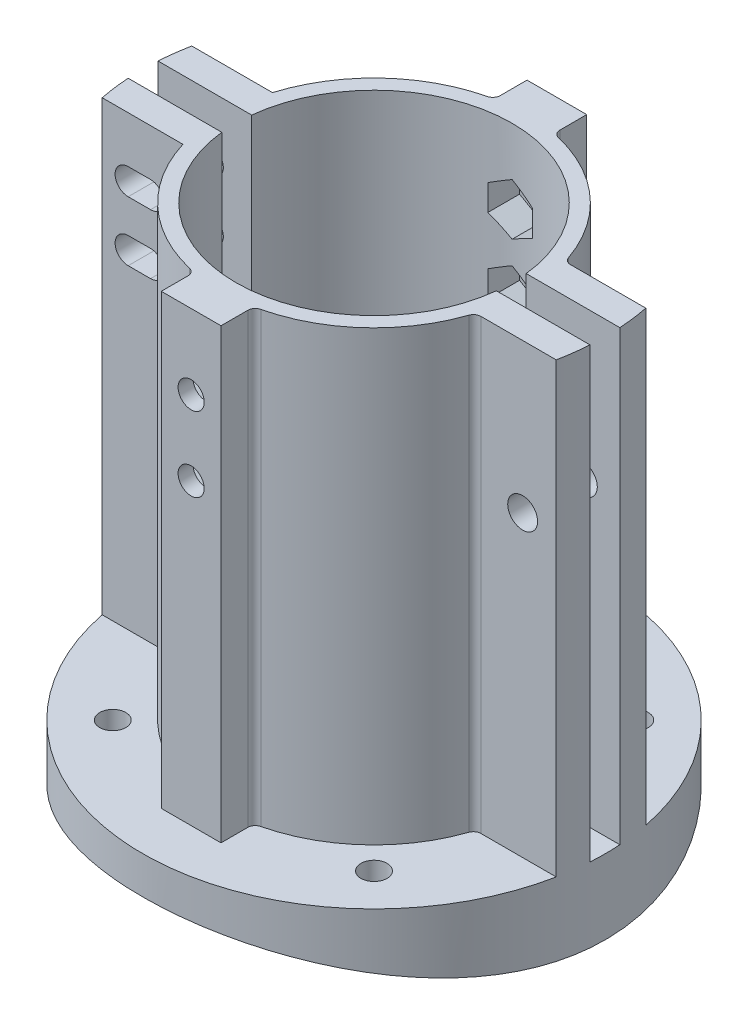
from build123d import *
from build123d.topology import SkipClean

# Parameters (mm, degrees)
SKETCH_1_R               = 31
SKETCH_1_R_2             = 1.75
SKETCH_1_R_3             = 18.5
EXTRUDE_1_DEPTH          = 10
CUT_EXTRUDE_1_DEPTH      = 45.966654312
CUT_EXTRUDE_1_DEPTH_BACK = 45.966654312
SKETCH_3_R               = 20.5
SKETCH_3_R_2             = 18.5
EXTRUDE_2_DEPTH          = 60
SKETCH_5_W               = 2.216851684
SKETCH_5_H               = 4
CUT_EXTRUDE_2_DEPTH      = 60
SKETCH_6_R               = 1.75
CUT_EXTRUDE_3_DEPTH      = 83.595399673
EXTRUDE_3_DEPTH          = 60
SKETCH_8_R               = 2
CUT_EXTRUDE_4_DEPTH      = 86.02940684
EXTRUDE_START            = -0.394031
SKETCH_9_W               = 8
SKETCH_9_H               = 60
SKETCH_9_R               = 1.75
EXTRUDE_4_DEPTH          = 4.394031
FILLET_1_R               = 1
CUT_EXTRUDE_START        = -3.5
CUT_EXTRUDE_5_DEPTH      = 7.5
MIRROR_START             = 48.267949192
MIRROR_1_DEPTH           = 3.464101616
MIRROR_START_2           = 58.267949192
MIRROR_1_2_DEPTH         = 3.464101616
MIRROR_START_3           = 10
MIRROR_1_3_DEPTH         = 38.267949192
MIRROR_START_4           = 48.2499999
MIRROR_1_4_DEPTH         = 21.7500001
MIRROR_START_5           = 61.732050808
MIRROR_1_5_DEPTH         = 8.267949192
MIRROR_START_6           = 51.732050808
MIRROR_1_6_DEPTH         = 6.535898384
MIRROR_START_7           = 17
MIRROR_1_7_DEPTH         = 5.5
MIRROR_START_8           = 22.5
MIRROR_1_8_OUTLINE_R     = 1.75
MIRROR_1_8_DEPTH         = 2.5
CUT_EXTRUDE_START_2      = -9
CUT_EXTRUDE_6_DEPTH      = 9
CUT_EXTRUDE_7_DEPTH      = 86.02940684
EXTRUDE_5_DEPTH          = 60


with BuildPart() as part:
    # Эскиз1 → Бобышка-Вытянуть1 (new body)
    with BuildSketch(Plane(origin=(0, 0, 0), x_dir=(1, 0, 0), z_dir=(0, 1, 0))):
        with Locations(Location((0, 0, 0), (0, 0, 270))):
            Circle(SKETCH_1_R)
        with Locations(Location((17.5, -17.5, 0), (0, 0, 270))):
            Circle(SKETCH_1_R_2, mode=Mode.SUBTRACT)
        with Locations(Location((-17.5, -17.5, 0), (0, 0, 270))):
            Circle(SKETCH_1_R_2, mode=Mode.SUBTRACT)
        with Locations(Location((-17.5, 17.5, 0), (0, 0, 270))):
            Circle(SKETCH_1_R_2, mode=Mode.SUBTRACT)
        with Locations(Location((17.5, 17.5, 0), (0, 0, 270))):
            Circle(SKETCH_1_R_2, mode=Mode.SUBTRACT)
        with Locations(Location((0, 0, 0), (0, 0, 270))):
            Circle(SKETCH_1_R_3, mode=Mode.SUBTRACT)
    extrude(amount=EXTRUDE_1_DEPTH)

    # Эскиз2 → Вырез-Вытянуть1 (cut, two sides: drawn at the far end of the back side and taken through both)
    with BuildSketch(Plane.XY.offset(-CUT_EXTRUDE_1_DEPTH_BACK)):
        with BuildLine():
            Line((-31, 0), (31, 0))
            ThreePointArc((31, 0), (0, 4.978725812), (-31, 0))
        make_face()
    extrude(amount=CUT_EXTRUDE_1_DEPTH + CUT_EXTRUDE_1_DEPTH_BACK, mode=Mode.SUBTRACT)

    # Эскиз3 → Бобышка-Вытянуть2 (add)
    with BuildSketch(Plane(origin=(0, 10, 0), x_dir=(1, 0, 0), z_dir=(0, 1, 0))):
        with Locations(Location((0, 0, 0), (0, 0, 270))):
            Circle(SKETCH_3_R)
        with Locations(Location((0, 0, 0), (0, 0, 90))):
            Circle(SKETCH_3_R_2, mode=Mode.SUBTRACT)
    extrude(amount=EXTRUDE_2_DEPTH)

    # Эскиз5 → Вырез-Вытянуть2 (cut)
    with BuildSketch(Plane(origin=(0, 70, 0), x_dir=(1, 0, 0), z_dir=(0, 1, 0))):
        with Locations((19.5, 0)):
            Rectangle(SKETCH_5_W, SKETCH_5_H)
        with Locations((-19.5, 0)):
            Rectangle(SKETCH_5_W, SKETCH_5_H)
    extrude(amount=-CUT_EXTRUDE_2_DEPTH, mode=Mode.SUBTRACT)

    # Эскиз6 → Вырез-Вытянуть3 (cut, through all)
    with BuildSketch(Plane.XY):
        with Locations(Location((0, 60, 0), (0, 0, 90))):
            Circle(SKETCH_6_R)
        with Locations(Location((0, 50, 0), (0, 0, 90))):
            Circle(SKETCH_6_R)
    extrude(amount=-CUT_EXTRUDE_3_DEPTH, mode=Mode.SUBTRACT)

    # Эскиз7 → Бобышка-Вытянуть3 (add)
    with SkipClean():  # the faces are left unmerged after this step: merging them gives an invalid solid
        with BuildSketch(Plane(origin=(0, 10, 0), x_dir=(1, 0, 0), z_dir=(0, 1, 0))):
            with BuildLine():
                Line((19.602295784, 6), (30.413812651, 6))
                ThreePointArc((30.413812651, 6), (30.739745971, 4.008493192), (30.935416597, 2))
                Line((30.935416597, 2), (20.402205763, 2))
                ThreePointArc((20.402205763, 2), (20.101990847, 4.01994577), (19.602295784, 6))
            make_face()
            with BuildLine():
                Line((19.602295784, -6), (30.413812651, -6))
                ThreePointArc((30.413812651, -6), (30.739745971, -4.008493192), (30.935416597, -2))
                Line((30.935416597, -2), (20.402205763, -2))
                ThreePointArc((20.402205763, -2), (20.101990847, -4.01994577), (19.602295784, -6))
            make_face()
            with BuildLine():
                Line((-20.402205763, -2), (-30.935416597, -2))
                ThreePointArc((-30.935416597, -2), (-30.739745971, -4.008493192), (-30.413812651, -6))
                Line((-30.413812651, -6), (-19.602295784, -6))
                ThreePointArc((-19.602295784, -6), (-20.101990847, -4.01994577), (-20.402205763, -2))
            make_face()
            with BuildLine():
                Line((-19.602295784, 6), (-30.413812651, 6))
                ThreePointArc((-30.413812651, 6), (-30.739745971, 4.008493192), (-30.935416597, 2))
                Line((-30.935416597, 2), (-20.402205763, 2))
                ThreePointArc((-20.402205763, 2), (-20.101990847, 4.01994577), (-19.602295784, 6))
            make_face()
        extrude(amount=EXTRUDE_3_DEPTH)

    # Эскиз8 → Вырез-Вытянуть4 (cut, through all)
    with SkipClean():  # the faces are left unmerged after this step: merging them gives an invalid solid
        with BuildSketch(Plane(origin=(0, 0, -6), x_dir=(-1, 0, 0), z_dir=(0, 0, -1))):
            with Locations((-25.913812651, 50)):
                Circle(SKETCH_8_R)
        extrude(amount=-CUT_EXTRUDE_4_DEPTH, mode=Mode.SUBTRACT)

    # Эскиз9 → Бобышка-Вытянуть4 (add)
    with SkipClean():  # the faces are left unmerged after this step: merging them gives an invalid solid
        with BuildSketch(Plane(origin=(0, 0, -20.5), x_dir=(-1, 0, 0), z_dir=(0, 0, -1)).offset(EXTRUDE_START)):
            with Locations((0, 40)):
                Rectangle(SKETCH_9_W, SKETCH_9_H)
            with Locations(Location((0, 60, 0), (0, 0, 270))):
                Circle(SKETCH_9_R, mode=Mode.SUBTRACT)
            with Locations(Location((0, 50, 0), (0, 0, 270))):
                Circle(SKETCH_9_R, mode=Mode.SUBTRACT)
        extrude(amount=EXTRUDE_4_DEPTH)

    # Скругление1
    fillet_1_edges = [part.edges().sort_by_distance(p)[0] for p in [
        (19.602295784, 40, -6),
        (19.602295784, 40, 6),
        (4, 40, -20.105969),
        (-4, 40, -20.105969),
    ]]
    fillet(fillet_1_edges, radius=FILLET_1_R)

    # Эскиз10 → Вырез-Вытянуть5 (cut)
    with SkipClean():  # the faces are left unmerged after this step: merging them gives an invalid solid
        with BuildSketch(Plane(origin=(0, 0, -18.5), x_dir=(-1, 0, 0), z_dir=(0, 0, -1)).offset(CUT_EXTRUDE_START)):
            Polygon((0, 56.535898385), (3, 58.267949192), (3, 61.732050808), (0, 63.464101615), (-3, 61.732050808), (-3, 58.267949192), align=None)
            Polygon((0, 46.535898385), (3, 48.267949192), (3, 51.732050808), (0, 53.464101615), (-3, 51.732050808), (-3, 48.267949192), align=None)
        extrude(amount=CUT_EXTRUDE_5_DEPTH, mode=Mode.SUBTRACT)

    # Зеркальное отражение1: read off the stored shape, not the designer's step
    # Зеркальное отражение1 outline → Зеркальное отражение1 (cut)
    with SkipClean():  # the faces are left unmerged after this step: merging them gives an invalid solid
        with BuildSketch(Plane(origin=(0, 0, 0), x_dir=(1, 0, 0), z_dir=(0, 1, 0)).offset(MIRROR_START)):
            with BuildLine():
                ThreePointArc((-3, -20.27929979), (0, -20.5), (3, -20.27929979))
                Line((3, -20.27929979), (3, -18.255136264))
                ThreePointArc((3, -18.255136264), (0, -18.5), (-3, -18.255136264))
                Line((-3, -18.255136264), (-3, -20.27929979))
            make_face()
        extrude(amount=MIRROR_1_DEPTH, mode=Mode.SUBTRACT)

    # Mirror 1 2 outline → Mirror 1 2 (cut)
    with SkipClean():  # the faces are left unmerged after this step: merging them gives an invalid solid
        with BuildSketch(Plane(origin=(0, 0, 0), x_dir=(1, 0, 0), z_dir=(0, 1, 0)).offset(MIRROR_START_2)):
            with BuildLine():
                ThreePointArc((-3, -20.27929979), (0, -20.5), (3, -20.27929979))
                Line((3, -20.27929979), (3, -18.255136264))
                ThreePointArc((3, -18.255136264), (0, -18.5), (-3, -18.255136264))
                Line((-3, -18.255136264), (-3, -20.27929979))
            make_face()
        extrude(amount=MIRROR_1_2_DEPTH, mode=Mode.SUBTRACT)

    # Mirror 1 3 outline → Mirror 1 3 (add)
    with SkipClean():  # the faces are left unmerged after this step: merging them gives an invalid solid
        with BuildSketch(Plane(origin=(0, 0, 0), x_dir=(1, 0, 0), z_dir=(0, 1, 0)).offset(MIRROR_START_3)):
            with BuildLine():
                Line((-4, -24.5), (4, -24.5))
                Line((4, -24.5), (4, -20.910523666))
                ThreePointArc((4, -20.910523666), (4.214965561, -20.291071545), (4.76744186, -19.93794117))
                ThreePointArc((4.76744186, -19.93794117), (0, -20.5), (-4.76744186, -19.93794117))
                ThreePointArc((-4.76744186, -19.93794117), (-4.214965561, -20.291071545), (-4, -20.910523666))
                Line((-4, -20.910523666), (-4, -24.5))
            make_face()
        extrude(amount=MIRROR_1_3_DEPTH)

    # Mirror 1 4 outline → Mirror 1 4 (add)
    with SkipClean():  # the faces are left unmerged after this step: merging them gives an invalid solid
        with BuildSketch(Plane(origin=(0, 0, 0), x_dir=(1, 0, 0), z_dir=(0, 1, 0)).offset(MIRROR_START_4)):
            with BuildLine():
                Line((-4, -24.5), (4, -24.5))
                Line((4, -24.5), (4, -20.910523666))
                ThreePointArc((4, -20.910523666), (4.214965561, -20.291071545), (4.76744186, -19.93794117))
                ThreePointArc((4.76744186, -19.93794117), (3.887469574, -20.128029717), (3, -20.27929979))
                Line((3, -20.27929979), (3, -22.5))
                Line((3, -22.5), (-3, -22.5))
                Line((-3, -22.5), (-3, -20.27929979))
                ThreePointArc((-3, -20.27929979), (-3.887469574, -20.128029717), (-4.76744186, -19.93794117))
                ThreePointArc((-4.76744186, -19.93794117), (-4.214965561, -20.291071545), (-4, -20.910523666))
                Line((-4, -20.910523666), (-4, -24.5))
            make_face()
        extrude(amount=MIRROR_1_4_DEPTH)

    # Mirror 1 5 outline → Mirror 1 5 (add)
    with SkipClean():  # the faces are left unmerged after this step: merging them gives an invalid solid
        with BuildSketch(Plane(origin=(0, 0, 0), x_dir=(1, 0, 0), z_dir=(0, 1, 0)).offset(MIRROR_START_5)):
            with BuildLine():
                Line((3, -22.5), (3, -20.27929979))
                ThreePointArc((3, -20.27929979), (0, -20.5), (-3, -20.27929979))
                Line((-3, -20.27929979), (-3, -22.5))
                Line((-3, -22.5), (3, -22.5))
            make_face()
        extrude(amount=MIRROR_1_5_DEPTH)

    # Mirror 1 6 outline → Mirror 1 6 (add)
    with SkipClean():  # the faces are left unmerged after this step: merging them gives an invalid solid
        with BuildSketch(Plane(origin=(0, 0, 0), x_dir=(1, 0, 0), z_dir=(0, 1, 0)).offset(MIRROR_START_6)):
            with BuildLine():
                Line((3, -22.5), (3, -20.27929979))
                ThreePointArc((3, -20.27929979), (0, -20.5), (-3, -20.27929979))
                Line((-3, -20.27929979), (-3, -22.5))
                Line((-3, -22.5), (3, -22.5))
            make_face()
        extrude(amount=MIRROR_1_6_DEPTH)

    # Mirror 1 7 outline → Mirror 1 7 (cut)
    with SkipClean():  # the faces are left unmerged after this step: merging them gives an invalid solid
        with BuildSketch(Plane.XY.offset(MIRROR_START_7)):
            Polygon((3, 51.732050808), (0, 53.464101615), (-3, 51.732050808), align=None)
            Polygon((3, 48.267949192), (-3, 48.267949192), (0, 46.535898385), align=None)
            Polygon((3, 61.732050808), (0, 63.464101615), (-3, 61.732050808), align=None)
            Polygon((3, 58.267949192), (-3, 58.267949192), (0, 56.535898385), align=None)
        extrude(amount=MIRROR_1_7_DEPTH, mode=Mode.SUBTRACT)

    # Mirror 1 8 outline → Mirror 1 8 (cut)
    with SkipClean():  # the faces are left unmerged after this step: merging them gives an invalid solid
        with BuildSketch(Plane.XY.offset(MIRROR_START_8)):
            with Locations((0, 50)):
                Circle(MIRROR_1_8_OUTLINE_R)
            with Locations((0, 60)):
                Circle(MIRROR_1_8_OUTLINE_R)
        extrude(amount=MIRROR_1_8_DEPTH, mode=Mode.SUBTRACT)

    # Вырез-Вытянуть6: read off the stored shape, not the designer's step
    # Вырез-Вытянуть6 outline → Вырез-Вытянуть6 (cut)
    with SkipClean():  # the faces are left unmerged after this step: merging them gives an invalid solid
        with BuildSketch(Plane(origin=(0, 10, 0), x_dir=(1, 0, 0), z_dir=(0, 1, 0)).offset(CUT_EXTRUDE_START_2)):
            with BuildLine():
                ThreePointArc((18.39157416, 1.999999981), (18.5, -9e-09), (18.391574158, -1.999999998))
                Line((18.391574158, -1.999999998), (22.391574158, -2))
                Line((22.391574158, -2), (22.391574158, 2))
                Line((22.391574158, 2), (18.39157416, 1.999999981))
            make_face()
            with BuildLine():
                Line((-22.391574158, -2), (-18.391574158, -2))
                ThreePointArc((-18.391574158, -2), (-18.5, -1e-08), (-18.39157416, 1.999999981))
                Line((-18.39157416, 1.999999981), (-22.391574158, 2))
                Line((-22.391574158, 2), (-22.391574158, -2))
            make_face()
        extrude(amount=CUT_EXTRUDE_6_DEPTH, mode=Mode.SUBTRACT)

    # Эскиз13 → Вырез-Вытянуть7 (cut, through all)
    with SkipClean():  # the faces are left unmerged after this step: merging them gives an invalid solid
        with BuildSketch(Plane(origin=(0, 0, -6), x_dir=(-1, 0, 0), z_dir=(0, 0, -1))):
            with BuildLine():
                Line((23.935416597, 63.75), (26.935416597, 63.75))
                ThreePointArc((26.935416597, 63.75), (28.685416597, 62), (26.935416597, 60.25))
                Line((26.935416597, 60.25), (23.935416597, 60.25))
                ThreePointArc((23.935416597, 60.25), (22.185416597, 62), (23.935416597, 63.75))
            make_face()
            with BuildLine():
                Line((23.935416597, 55.75), (26.935416597, 55.75))
                ThreePointArc((26.935416597, 55.75), (28.685416597, 54), (26.935416597, 52.25))
                Line((26.935416597, 52.25), (23.935416597, 52.25))
                ThreePointArc((23.935416597, 52.25), (22.185416597, 54), (23.935416597, 55.75))
            make_face()
        extrude(amount=-CUT_EXTRUDE_7_DEPTH, mode=Mode.SUBTRACT)

    # Эскиз14 → Бобышка-Вытянуть5 (add)
    with SkipClean():  # the faces are left unmerged after this step: merging them gives an invalid solid
        with BuildSketch(Plane(origin=(0, 70, 0), x_dir=(1, 0, 0), z_dir=(0, 1, 0))):
            with BuildLine():
                Line((-19.602295784, 6), (-19.602295784, 14))
                Line((-19.602295784, 14), (-14.974979132, 14))
                ThreePointArc((-14.974979132, 14), (-17.745336997, 10.264161673), (-19.602295784, 6))
            make_face()
            with BuildLine():
                Line((-19.602295784, -14), (-14.974979132, -14))
                ThreePointArc((-14.974979132, -14), (-17.745336997, -10.264161673), (-19.602295784, -6))
                Line((-19.602295784, -6), (-19.602295784, -14))
            make_face()
        extrude(amount=EXTRUDE_5_DEPTH)


with BuildPart() as extrude_5_kept_piece:
    # of the separate pieces the step leaves, the one the design keeps (extrude_5_pieces_kept)
    add(part.part.solids().sort_by_distance((19.383037334, 10, 6.674418605))[0])


solid = extrude_5_kept_piece.part
